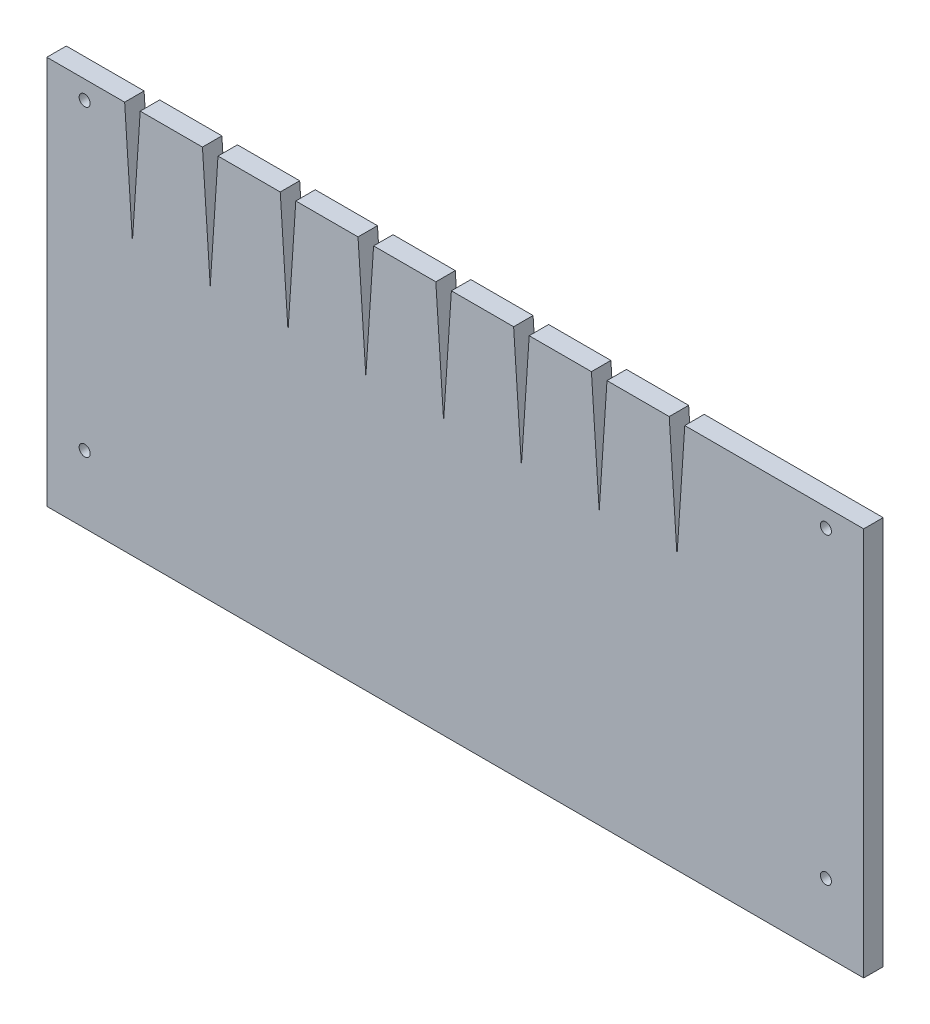
from build123d import *

# Parameters (mm, degrees)
SKETCH1_W            = 266.7
SKETCH1_H            = 127
BOSS_EXTRUDE1_DEPTH  = 6.35
M3_CLEARANCE_HOLE1_D = 3.6
CUT_EXTRUDE3_DEPTH   = 296.462709153
LPATTERN1_COUNT      = 8
LPATTERN1_PITCH      = 25.4


with BuildPart() as part:
    # Sketch1 → Boss-Extrude1 (new body)
    with BuildSketch(Plane.XY):
        with Locations((133.35, 63.5)):
            Rectangle(SKETCH1_W, SKETCH1_H)
    extrude(amount=BOSS_EXTRUDE1_DEPTH)

    # M3 Clearance Hole1 (through all)
    with Locations(Plane.XY.offset(6.35)):
        with Locations((12.3444, 121.0056), (12.3444, 21.9964), (254.3556, 21.9964), (254.3556, 121.0056)):
            Hole(M3_CLEARANCE_HOLE1_D / 2)

    # Sketch6 → Cut-Extrude3 (cut, through all)
    with BuildSketch(Plane.XY.offset(6.35)):
        Polygon((25.4, 127), (27.94, 88.9), (30.48, 127), align=None)
    cut_extrude3 = extrude(amount=-CUT_EXTRUDE3_DEPTH, mode=Mode.SUBTRACT)

    # LPattern1: Cut-Extrude3 ×8
    with Locations(*[(i * LPATTERN1_PITCH, 0, 0) for i in range(1, LPATTERN1_COUNT)]):
        add(cut_extrude3, mode=Mode.SUBTRACT)


solid = part.part
